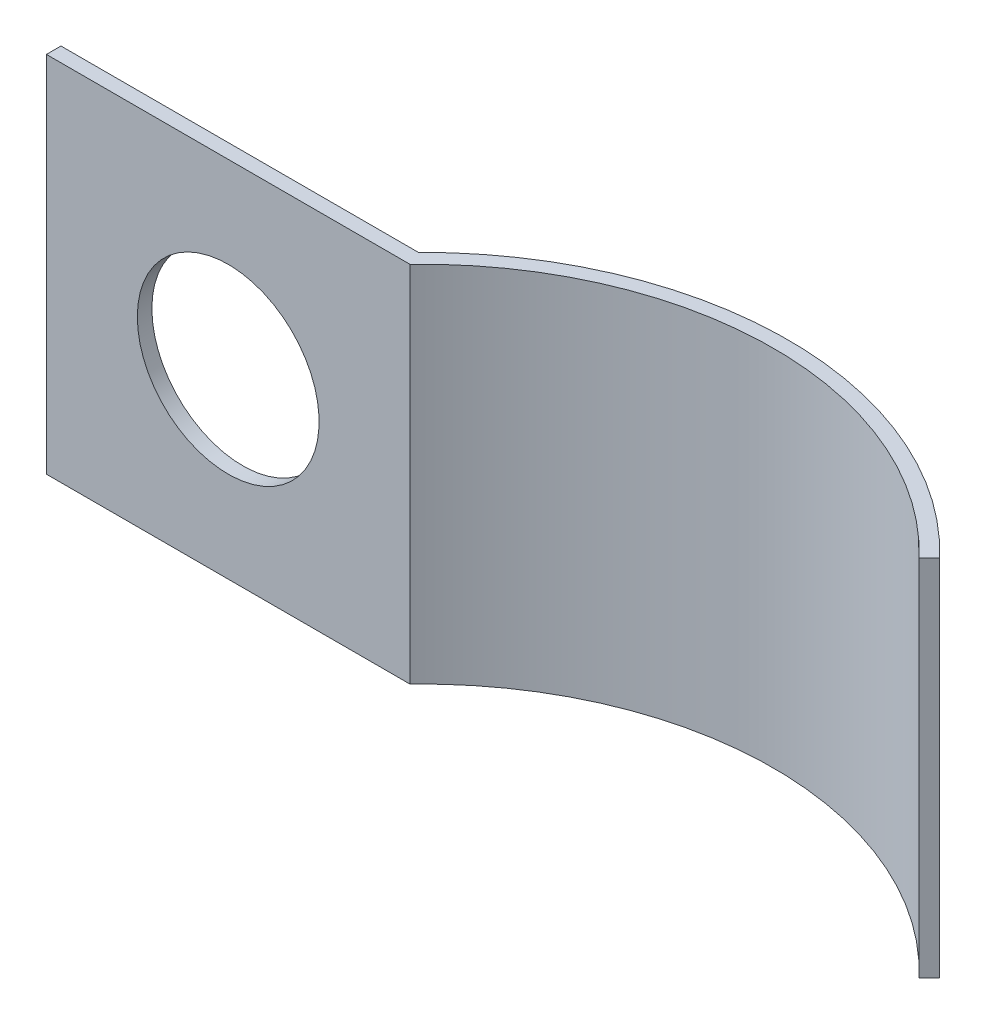
from build123d import *

# Parameters (mm, degrees)
EXTRUDE_1_DEPTH     = 5
SKETCH_2_R          = 1.25
CUT_EXTRUDE_1_DEPTH = 5


with BuildPart() as part:
    # 草图1 → 凸台-拉伸1 (new body)
    with BuildSketch(Plane(origin=(0, 0, 0), x_dir=(1, 0, 0), z_dir=(0, 1, 0))):
        with BuildLine():
            Line((0, 0), (5, 0))
            ThreePointArc((5, 0), (8.5, 1.5), (12, 0))
            Line((12, 0), (12.141461743, 0.141461743))
            ThreePointArc((12.141461743, 0.141461743), (8.540773142, 1.699834853), (4.915310334, 0.2))
            Line((4.915310334, 0.2), (0, 0.2))
            Line((0, 0.2), (0, 0))
        make_face()
    extrude(amount=EXTRUDE_1_DEPTH)

    # 草图2 → 切除-拉伸1 (cut)
    with BuildSketch(Plane(origin=(0, 0, -0.2), x_dir=(-1, 0, 0), z_dir=(0, 0, -1))):
        with Locations((-2.5, 2.5)):
            Circle(SKETCH_2_R)
    extrude(amount=-CUT_EXTRUDE_1_DEPTH, mode=Mode.SUBTRACT)


solid = part.part
